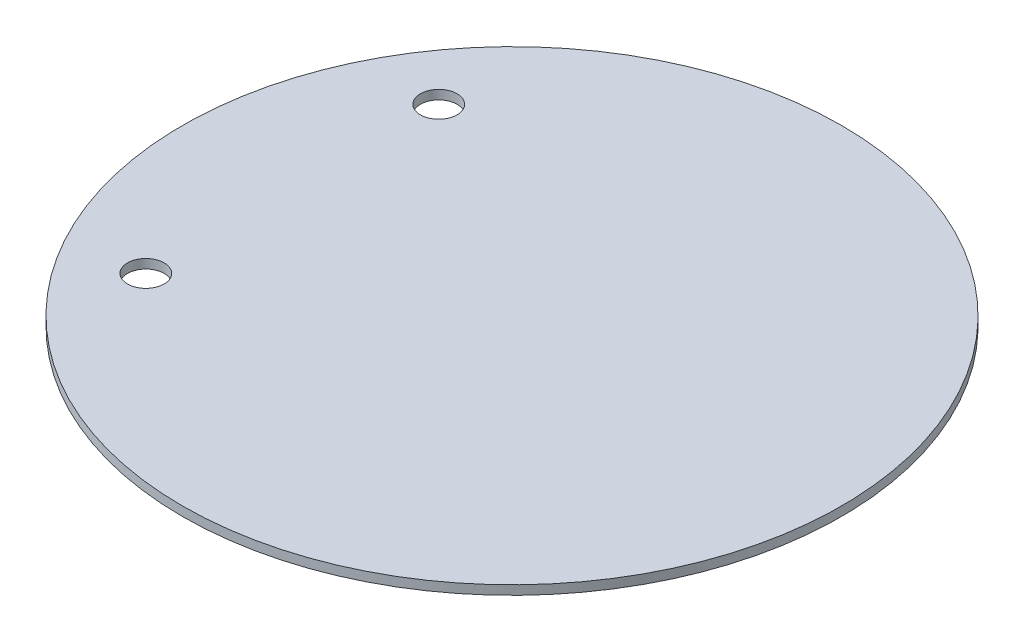
from build123d import *

# Parameters (mm, degrees)
SKETCH1_R           = 57.15
SKETCH1_R_2         = 3.175
BOSS_EXTRUDE1_DEPTH = 1.5875


with BuildPart() as part:
    # Sketch1 → Boss-Extrude1 (new body)
    with BuildSketch(Plane(origin=(0, 0, 0), x_dir=(1, 0, 0), z_dir=(0, 1, 0))):
        Circle(SKETCH1_R)
        with Locations((-38.1, 25.4)):
            Circle(SKETCH1_R_2, mode=Mode.SUBTRACT)
        with Locations((-38.1, -25.4)):
            Circle(SKETCH1_R_2, mode=Mode.SUBTRACT)
    extrude(amount=BOSS_EXTRUDE1_DEPTH)


solid = part.part
